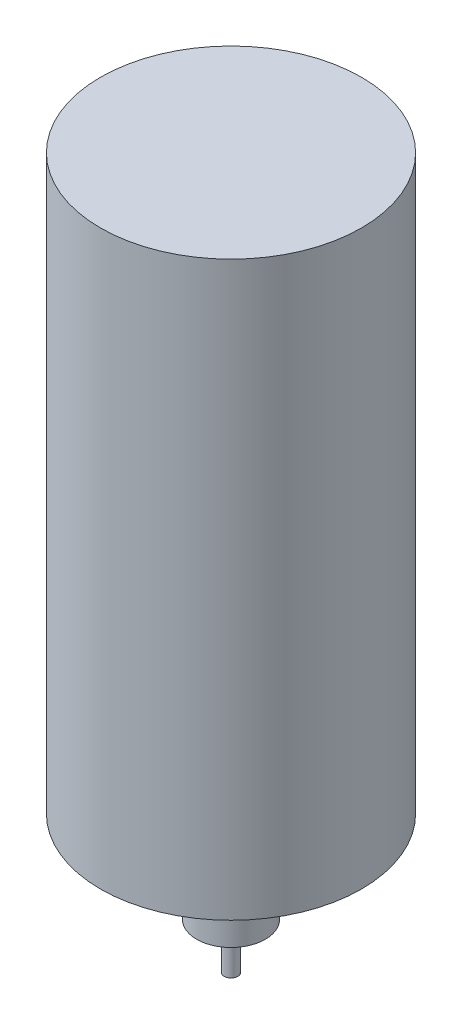
from build123d import *

# Parameters (mm, degrees)
SKETCH1_R           = 28.5
BOSS_EXTRUDE1_DEPTH = 62.5
SKETCH2_R           = 7.5
BOSS_EXTRUDE2_DEPTH = 20
SKETCH3_R           = 1.5
BOSS_EXTRUDE3_DEPTH = 10


with BuildPart() as part:
    # Sketch1 → Boss-Extrude1 (new, symmetric)
    with BuildSketch(Plane(origin=(0, 0, 0), x_dir=(1, 0, 0), z_dir=(0, 1, 0))):
        Circle(SKETCH1_R)
    extrude(amount=BOSS_EXTRUDE1_DEPTH, both=True)

    # Sketch2 → Boss-Extrude2 (add)
    with BuildSketch(Plane.XZ.offset(62.5)):
        Circle(SKETCH2_R)
    extrude(amount=BOSS_EXTRUDE2_DEPTH)

    # Sketch3 → Boss-Extrude3 (add)
    with BuildSketch(Plane.XZ.offset(82.5)):
        Circle(SKETCH3_R)
    extrude(amount=BOSS_EXTRUDE3_DEPTH)


solid = part.part
